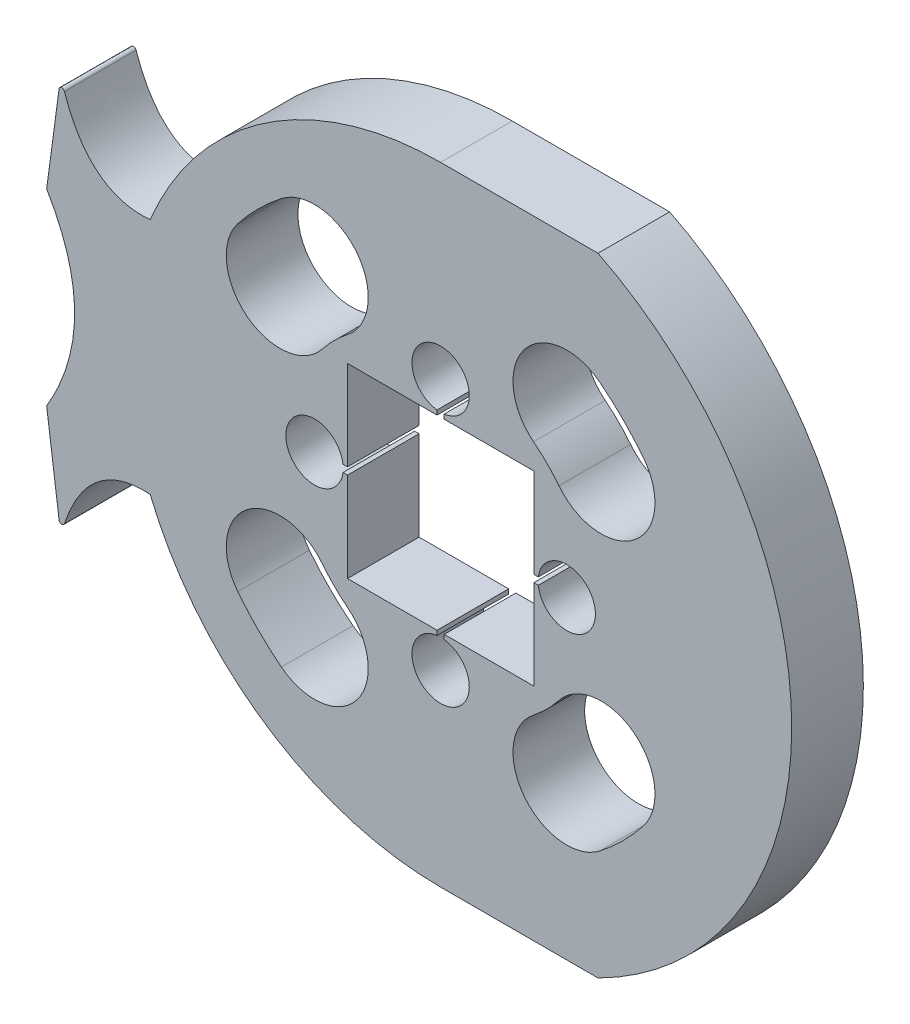
from build123d import *

# Parameters (mm, degrees)
BOSS_EXTRUDE1_DEPTH = 6.35


with BuildPart() as part:
    # Sketch1 → Boss-Extrude1 (new body)
    with BuildSketch(Plane.XY):
        with BuildLine():
            Line((13.949202701, 27.813), (0, 27.813))
            ThreePointArc((0, 27.813), (-15.495722247, 23.096440441), (-25.735880772, 10.546440626))
            add(Edge.make_bspline(
                [(-33.335263894, 16.577622785), (-31.897734861, 12.244147731), (-29.218007482, 10.187725291), (-25.735880772, 10.546440626)],
                knots=[0.081540764, 0.081540764, 0.081540764, 0.081540764, 1, 1, 1, 1], degree=3))
            ThreePointArc((-33.335263894, 16.577622785), (-33.559636624, 16.751099462), (-33.804841532, 16.608579877))
            Line((-33.804841532, 16.608579877), (-34.917209585, 8.319768485))
            add(Edge.make_bspline(
                [(-34.917209585, 8.319768485), (-29.956448806, 0), (-34.917209585, -8.319768485)],
                knots=[0, 0, 0, 1, 1, 1], degree=2))
            Line((-34.917209585, -8.319768485), (-33.804841532, -16.608579877))
            ThreePointArc((-33.804841532, -16.608579877), (-33.559636624, -16.751099462), (-33.335263894, -16.577622785))
            add(Edge.make_bspline(
                [(-33.335263894, -16.577622785), (-31.897734861, -12.244147731), (-29.230448697, -10.289617961), (-25.735880772, -10.546440626)],
                knots=[0.081540764, 0.081540764, 0.081540764, 0.081540764, 1, 1, 1, 1], degree=3))
            ThreePointArc((-25.735880772, -10.546440626), (-15.495722247, -23.096440441), (0, -27.813))
            Line((0, -27.813), (13.949202701, -27.813))
            ThreePointArc((13.949202701, -27.813), (31.115, 0), (13.949202701, 27.813))
        make_face()
        with BuildLine():
            ThreePointArc((-17.980223163, -14.117052632), (-17.175395969, -7.430120174), (-10.488463512, -8.234947368))
            ThreePointArc((-10.488463512, -8.234947368), (-9.429268927, -9.429268927), (-8.234947368, -10.488463512))
            ThreePointArc((-8.234947368, -10.488463512), (-7.430120174, -17.175395969), (-14.117052632, -17.980223163))
            ThreePointArc((-14.117052632, -17.980223163), (-16.164461018, -16.164461018), (-17.980223163, -14.117052632))
        make_face(mode=Mode.SUBTRACT)
        with BuildLine():
            ThreePointArc((14.117052632, -17.980223163), (7.430120174, -17.175395969), (8.234947368, -10.488463512))
            ThreePointArc((8.234947368, -10.488463512), (9.429268927, -9.429268927), (10.488463512, -8.234947368))
            ThreePointArc((10.488463512, -8.234947368), (17.175395969, -7.430120174), (17.980223163, -14.117052632))
            ThreePointArc((17.980223163, -14.117052632), (16.164461018, -16.164461018), (14.117052632, -17.980223163))
        make_face(mode=Mode.SUBTRACT)
        with BuildLine():
            ThreePointArc((-10.488463512, 8.234947368), (-17.175395969, 7.430120174), (-17.980223163, 14.117052632))
            ThreePointArc((-17.980223163, 14.117052632), (-16.164461018, 16.164461018), (-14.117052632, 17.980223163))
            ThreePointArc((-14.117052632, 17.980223163), (-7.430120174, 17.175395969), (-8.234947368, 10.488463512))
            ThreePointArc((-8.234947368, 10.488463512), (-9.429268927, 9.429268927), (-10.488463512, 8.234947368))
        make_face(mode=Mode.SUBTRACT)
        with BuildLine():
            Line((-8.255, 0.3175), (-8.255, 8.255))
            Line((-8.255, 8.255), (-0.3175, 8.255))
            Line((-0.3175, 8.255), (-0.3175, 8.655921876))
            ThreePointArc((-0.3175, 8.655921876), (-1.680052083, 13.081), (2.54, 11.176))
            ThreePointArc((2.54, 11.176), (1.905, 9.495947917), (0.3175, 8.655921876))
            Line((0.3175, 8.655921876), (0.3175, 8.255))
            Line((0.3175, 8.255), (8.255, 8.255))
            Line((8.255, 8.255), (8.255, 0.3175))
            Line((8.255, 0.3175), (8.655921876, 0.3175))
            ThreePointArc((8.655921876, 0.3175), (11.335062198, 2.535014638), (13.716, 0))
            ThreePointArc((13.716, 0), (11.335062198, -2.535014638), (8.655921876, -0.3175))
            Line((8.655921876, -0.3175), (8.255, -0.3175))
            Line((8.255, -0.3175), (8.255, -8.255))
            Line((8.255, -8.255), (0.3175, -8.255))
            Line((0.3175, -8.255), (0.3175, -8.655921876))
            ThreePointArc((0.3175, -8.655921876), (1.905, -9.495947917), (2.54, -11.176))
            ThreePointArc((2.54, -11.176), (-1.680052083, -13.081), (-0.3175, -8.655921876))
            Line((-0.3175, -8.655921876), (-0.3175, -8.255))
            Line((-0.3175, -8.255), (-8.255, -8.255))
            Line((-8.255, -8.255), (-8.255, -0.3175))
            Line((-8.255, -0.3175), (-8.655921876, -0.3175))
            ThreePointArc((-8.655921876, -0.3175), (-13.716, 0), (-8.655921876, 0.3175))
            Line((-8.655921876, 0.3175), (-8.255, 0.3175))
        make_face(mode=Mode.SUBTRACT)
        with BuildLine():
            ThreePointArc((17.980223163, 14.117052632), (17.175395969, 7.430120174), (10.488463512, 8.234947368))
            ThreePointArc((10.488463512, 8.234947368), (9.429268927, 9.429268927), (8.234947368, 10.488463512))
            ThreePointArc((8.234947368, 10.488463512), (7.430120174, 17.175395969), (14.117052632, 17.980223163))
            ThreePointArc((14.117052632, 17.980223163), (16.164461018, 16.164461018), (17.980223163, 14.117052632))
        make_face(mode=Mode.SUBTRACT)
    extrude(amount=BOSS_EXTRUDE1_DEPTH)


solid = part.part
